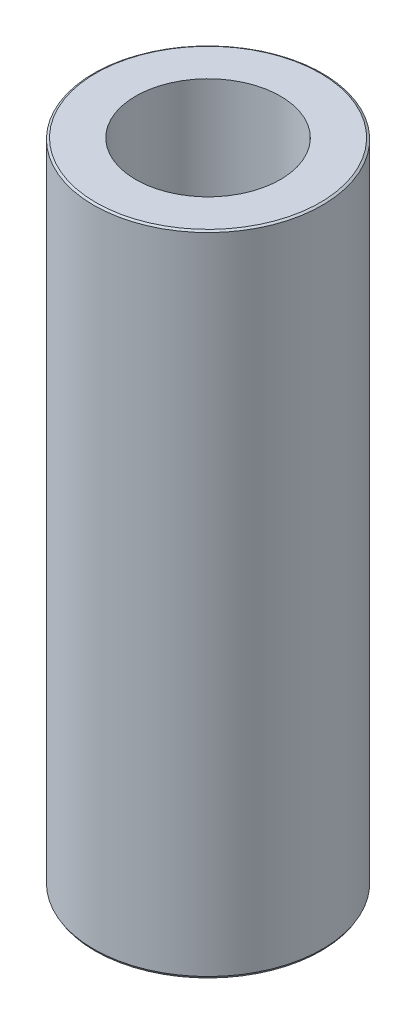
from build123d import *
from OCP.BRepFilletAPI import BRepFilletAPI_MakeChamfer

# Parameters (mm, degrees)
SKETCH1_R           = 45
BOSS_EXTRUDE1_DEPTH = 254.982256506
SKETCH2_R           = 28.490668701
CUT_EXTRUDE1_DEPTH  = 263.804016585
CHAMFER1_SIZE       = 0.492447844
CHAMFER1_SIZE2      = 0.851205837


with BuildPart() as part:
    # Sketch1 → Boss-Extrude1 (new body)
    with BuildSketch(Plane(origin=(0, 0, 0), x_dir=(1, 0, 0), z_dir=(0, 1, 0))):
        Circle(SKETCH1_R)
    extrude(amount=BOSS_EXTRUDE1_DEPTH)

    # Sketch2 → Cut-Extrude1 (cut, through all)
    with BuildSketch(Plane(origin=(0, 0, 0), x_dir=(1, 0, 0), z_dir=(0, 1, 0))):
        Circle(SKETCH2_R)
    extrude(amount=CUT_EXTRUDE1_DEPTH, mode=Mode.SUBTRACT)

    # Chamfer1: one chamfer whose edges measure the first distance from different faces: ONE call of the kernel's chamfer builder (chamfer() names one face for all edges)
    chamfer1_edges_1 = [part.edges().sort_by_distance(p)[0] for p in [
        (-45, 254.982256506, 0),
    ]]
    chamfer1_side_1 = [part.faces().sort_by_distance(p)[0] for p in [
        (-45, 127.491128253, 0),
    ]]
    chamfer1_edges_2 = [part.edges().sort_by_distance(p)[0] for p in [
        (-45, 0, 0),
    ]]
    chamfer1_side_2 = [part.faces().sort_by_distance(p)[0] for p in [
        (-43.727207794, 0, 0),
    ]]
    chamfer1 = BRepFilletAPI_MakeChamfer(part.part.solid().wrapped)
    for e in chamfer1_edges_1:
        chamfer1.Add(CHAMFER1_SIZE, CHAMFER1_SIZE2, e.wrapped, chamfer1_side_1[0].wrapped)  # the first distance lies on this face
    for e in chamfer1_edges_2:
        chamfer1.Add(CHAMFER1_SIZE, CHAMFER1_SIZE2, e.wrapped, chamfer1_side_2[0].wrapped)  # the first distance lies on this face
    add(Compound.cast(chamfer1.Shape()), mode=Mode.REPLACE)


solid = part.part
